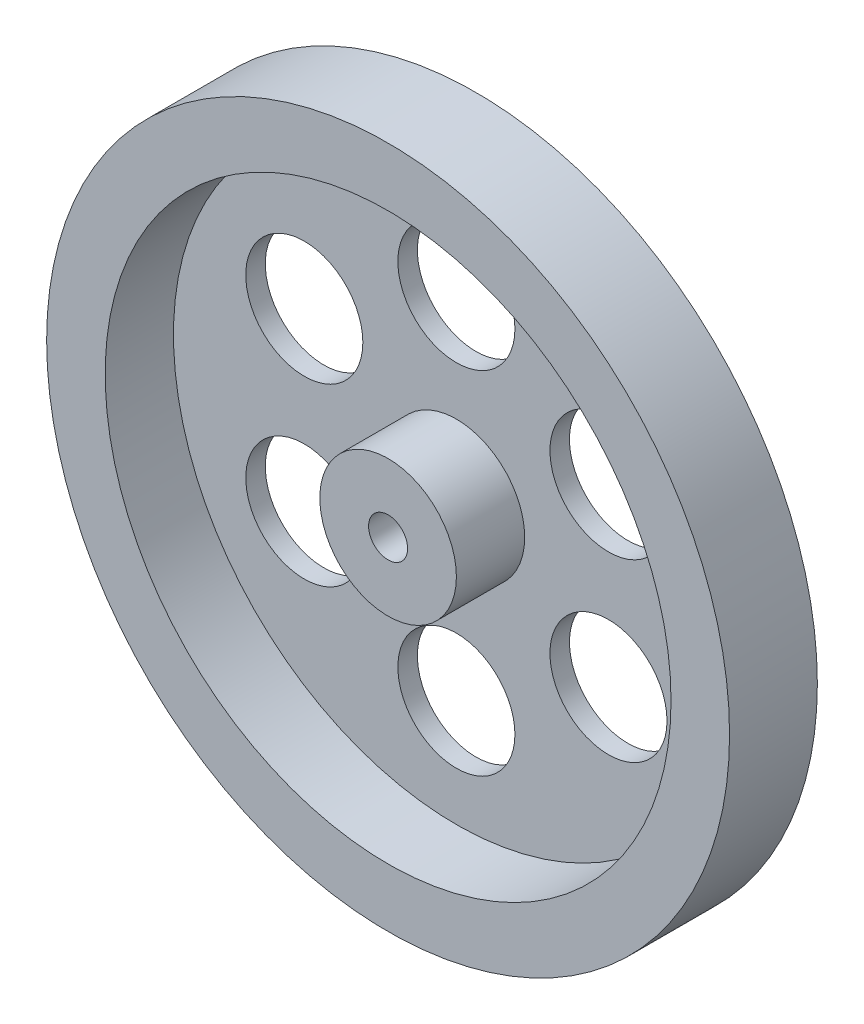
from build123d import *

# Parameters (mm, degrees)
SKETCH1_R               = 35
BOSS_EXTRUDE1_DEPTH     = 9
CUT_EXTRUDE1_DEPTH      = 51.309044912
CUT_EXTRUDE1_DEPTH_BACK = 51.309044912
SKETCH2_R               = 2
SKETCH3_R               = 29
SKETCH3_R_2             = 7
CUT_EXTRUDE2_DEPTH      = 7
SKETCH4_R               = 6
CUT_EXTRUDE3_DEPTH      = 50.989999


with BuildPart() as part:
    # Sketch1 → Boss-Extrude1 (new body)
    with BuildSketch(Plane.XY):
        Circle(SKETCH1_R)
    extrude(amount=BOSS_EXTRUDE1_DEPTH)

    # Sketch2 → Cut-Extrude1 (cut, two sides: drawn at the far end of the back side and taken through both)
    with BuildSketch(Plane.XY.offset(9).offset(-CUT_EXTRUDE1_DEPTH_BACK)):
        Circle(SKETCH2_R)
    extrude(amount=CUT_EXTRUDE1_DEPTH + CUT_EXTRUDE1_DEPTH_BACK, mode=Mode.SUBTRACT)

    # Sketch3 → Cut-Extrude2 (cut)
    with BuildSketch(Plane.XY.offset(9)):
        Circle(SKETCH3_R)
        Circle(SKETCH3_R_2, mode=Mode.SUBTRACT)
    extrude(amount=-CUT_EXTRUDE2_DEPTH, mode=Mode.SUBTRACT)

    # Sketch4 → Cut-Extrude3 (cut, through all)
    with BuildSketch(Plane.XY.offset(2)):
        with Locations((0, 18)):
            Circle(SKETCH4_R)
        with Locations((15.588457268, 9)):
            Circle(SKETCH4_R)
        with Locations((15.588457268, -9)):
            Circle(SKETCH4_R)
        with Locations((0, -18)):
            Circle(SKETCH4_R)
        with Locations((-15.588457268, -9)):
            Circle(SKETCH4_R)
        with Locations((-15.588457268, 9)):
            Circle(SKETCH4_R)
    extrude(amount=-CUT_EXTRUDE3_DEPTH, mode=Mode.SUBTRACT)


solid = part.part
